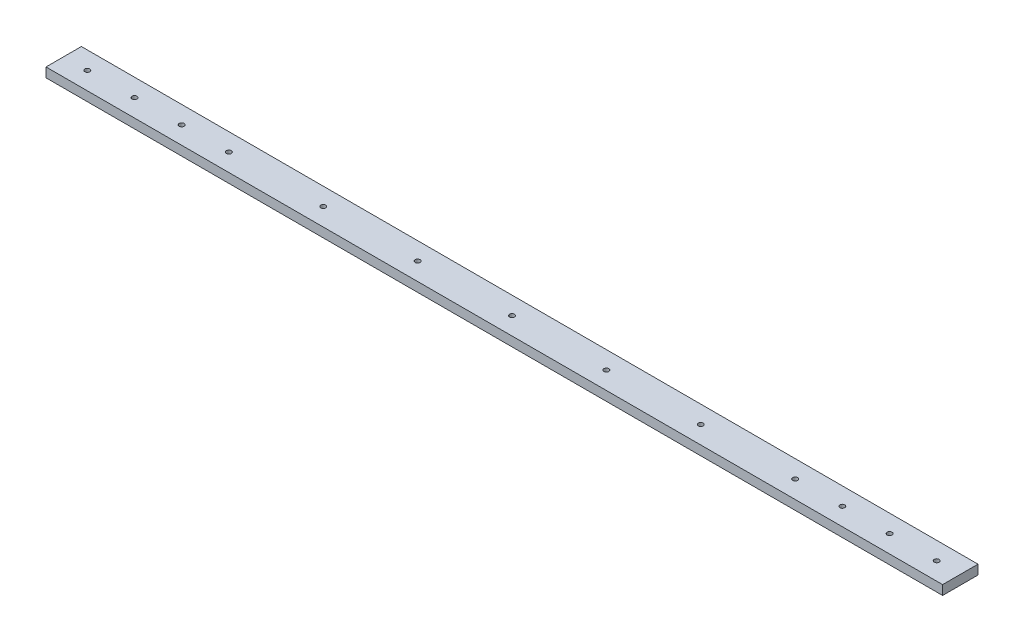
from build123d import *

# Parameters (mm, degrees)
SKETCH1_W           = 760
SKETCH1_H           = 30
BOSS_EXTRUDE1_DEPTH = 8
M5_TAPPED_HOLE1_D   = 4.2
M5_TAPPED_HOLE3_D   = 4.2


with BuildPart() as part:
    # Sketch1 → Boss-Extrude1 (new body)
    with BuildSketch(Plane(origin=(0, 0, 0), x_dir=(1, 0, 0), z_dir=(0, 1, 0))):
        Rectangle(SKETCH1_W, SKETCH1_H)
    extrude(amount=BOSS_EXTRUDE1_DEPTH)

    # M5 Tapped Hole1 (through all)
    with Locations(Plane(origin=(0, 8, 0), x_dir=(1, 0, 0), z_dir=(0, 1, 0))):
        with Locations((0, 0), (80, 0), (160, 0), (240, 0), (320, 0), (-80, 0), (-160, 0), (-240, 0), (-320, 0)):
            Hole(M5_TAPPED_HOLE1_D / 2)

    # M5 Tapped Hole3 (through all)
    with Locations(Plane(origin=(0, 0, 0), x_dir=(-1, 0, 0), z_dir=(0, -1, 0))):
        with Locations((-280, 0), (-360, 0), (360, 0), (280, 0)):
            Hole(M5_TAPPED_HOLE3_D / 2)


solid = part.part
